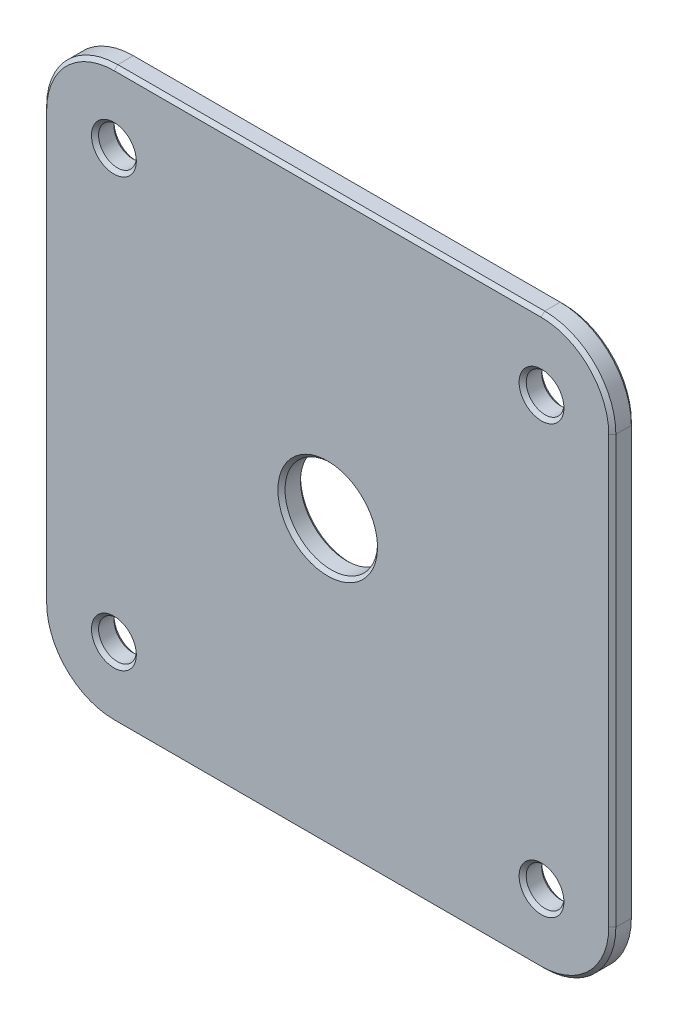
from build123d import *

# Parameters (mm, degrees)
SKETCH1_W              = 80
SKETCH1_H              = 80
F_1_8_INCH_SHEET_DEPTH = 1.5875
M5_CLEARANCE_HOLE1_D   = 5.3
M12_CLEARANCE_HOLE1_D  = 13
FILLET1_10MM_R         = 10
CHAMFER1_0_5MM_SIZE    = 0.5


with BuildPart() as part:
    # Sketch1 → 1/8 Inch Sheet (new, symmetric)
    with BuildSketch(Plane.XY):
        Rectangle(SKETCH1_W, SKETCH1_H)
    extrude(amount=F_1_8_INCH_SHEET_DEPTH, both=True)

    # M5 Clearance Hole1 (through all)
    with Locations(Plane(origin=(0, 0, -1.5875), x_dir=(-1, 0, 0), z_dir=(0, 0, -1))):
        with Locations((30.0520382, -30.0520382), (30.0520382, 30.0520382), (-30.0520382, 30.0520382), (-30.0520382, -30.0520382)):
            Hole(M5_CLEARANCE_HOLE1_D / 2)

    # M12 Clearance Hole1 (through all)
    with Locations(Plane.XY.offset(1.5875)):
        with Locations((0, 0)):
            Hole(M12_CLEARANCE_HOLE1_D / 2)

    # Fillet1 - 10mm
    fillet1_10mm_edges = [part.edges().sort_by_distance(p)[0] for p in [
        (40, -40, 0),
        (-40, -40, 0),
        (-40, 40, 0),
        (40, 40, 0),
    ]]
    fillet(fillet1_10mm_edges, radius=FILLET1_10MM_R)

    # Chamfer1 - 0.5mm
    chamfer1_0_5mm_edges = [part.edges().sort_by_distance(p)[0] for p in [
        (-37.071067812, -37.071067812, 1.5875),
        (-40, 0, 1.5875),
        (-37.071067812, 37.071067812, 1.5875),
        (0, 40, 1.5875),
        (37.071067812, 37.071067812, 1.5875),
        (40, 0, 1.5875),
        (37.071067812, -37.071067812, 1.5875),
        (0, -40, 1.5875),
        (-32.7020382, -30.0520382, 1.5875),
        (27.4020382, -30.0520382, 1.5875),
        (27.4020382, 30.0520382, 1.5875),
        (-32.7020382, 30.0520382, 1.5875),
        (6.5, 0, 1.5875),
        (37.071067812, 37.071067812, -1.5875),
        (0, 40, -1.5875),
        (-37.071067812, 37.071067812, -1.5875),
        (-40, 0, -1.5875),
        (-37.071067812, -37.071067812, -1.5875),
        (0, -40, -1.5875),
        (37.071067812, -37.071067812, -1.5875),
        (40, 0, -1.5875),
        (-32.7020382, -30.0520382, -1.5875),
        (27.4020382, -30.0520382, -1.5875),
        (27.4020382, 30.0520382, -1.5875),
        (-32.7020382, 30.0520382, -1.5875),
        (6.5, 0, -1.5875),
    ]]
    chamfer(chamfer1_0_5mm_edges, length=CHAMFER1_0_5MM_SIZE)


solid = part.part
